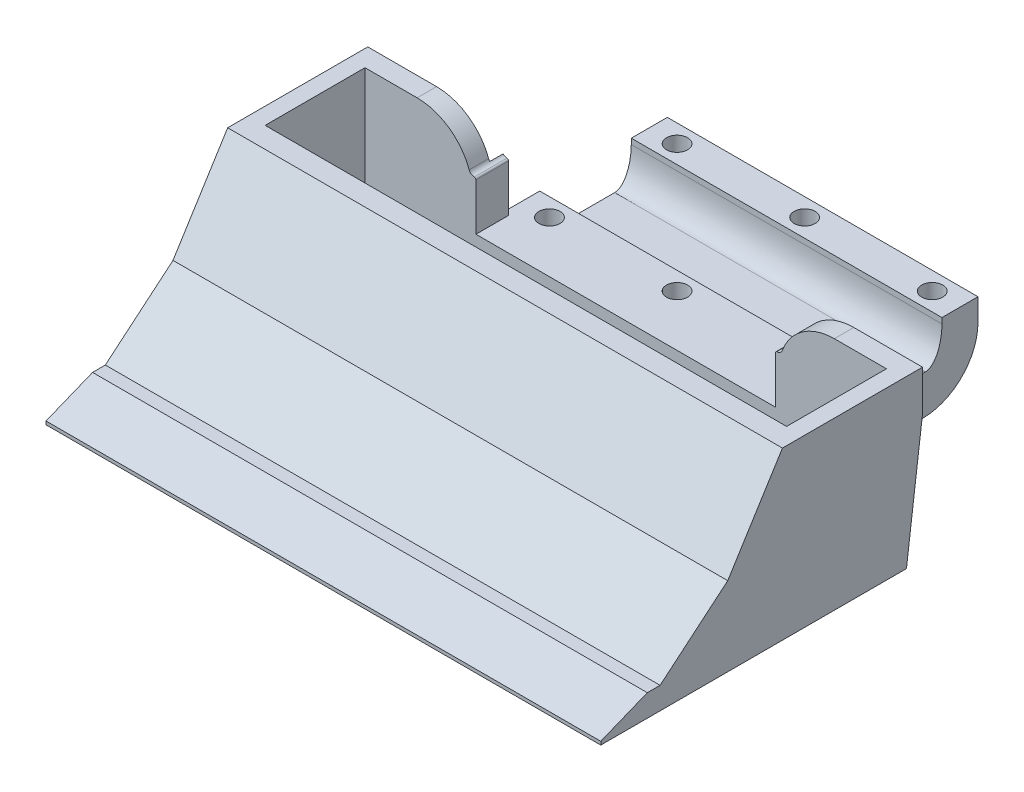
from build123d import *

# Parameters (mm, degrees)
RESSALTO_EXTRUS_O1_DEPTH = 30
CORTE_EXTRUS_O1_DEPTH    = 100
ESBO_O4_W                = 94
ESBO_O4_H                = 25
CORTE_EXTRUS_O2_DEPTH    = 10
ESBO_O5_W                = 94
ESBO_O5_H                = 18
CORTE_EXTRUS_O3_DEPTH    = 20
CORTE_EXTRUS_O7_START    = -3
CORTE_EXTRUS_O7_DEPTH    = 94
ESBO_O8_W                = 32
ESBO_O8_H                = 15
CORTE_EXTRUS_O8_DEPTH    = 56
ESBO_O9_W                = 16.5
ESBO_O9_H                = 8
CORTE_EXTRUS_O9_DEPTH    = 56
FILETE1_SIZE             = 3
FILETE1_SIZE_2           = 6
FILETE2_SIZE             = 3
FILETE2_SIZE_2           = 6
FILETE3_R                = 10
ESBO_O12_W               = 32
ESBO_O12_H               = 1
CORTE_EXTRUS_O12_DEPTH   = 68
CORTE_EXTRUS_O13_REACH   = 121.432
ESBO_O14_W               = 56
ESBO_O14_H               = 16
CORTE_EXTRUS_O14_DEPTH   = 138.840487586
ESBO_O16_R               = 1.9
CORTE_EXTRUS_O15_DEPTH   = 136.484316502
ESBO_O19_W               = 5.89
ESBO_O19_H               = 8.8
RESSALTO_EXTRUS_O4_DEPTH = 1
ESBO_O20_W               = 5.89
ESBO_O20_H               = 8.8
RESSALTO_EXTRUS_O5_DEPTH = 1
FILETE5_R                = 10
FILETE6_R                = 0.3
FILETE7_R                = 1
CORTE_EXTRUS_O17_DEPTH   = 22
CORTE_EXTRUS_O18_DEPTH   = 22
CORTE_EXTRUS_O19_DEPTH   = 124


with BuildPart() as part:
    # Esboço2 → Ressalto-extrusão1 (new body)
    with BuildSketch(Plane(origin=(0, 0, 0), x_dir=(1, 0, 0), z_dir=(0, 1, 0))):
        Polygon((0, 0), (0, 58), (22, 58), (22, 90), (78, 90), (78, 58), (100, 58), (100, 0), align=None)
    extrude(amount=RESSALTO_EXTRUS_O1_DEPTH)

    # Esboço3 → Corte-extrusão1 (cut)
    with BuildSketch(Plane(origin=(100, 0, 0), x_dir=(0, 0, -1), z_dir=(1, 0, 0))):
        Polygon((0, 0.6), (9.828405069, 4.570933406), (22.126818959, 14.890527965), (31.568264957, 30), (0, 30), align=None)
    extrude(amount=-CORTE_EXTRUS_O1_DEPTH, mode=Mode.SUBTRACT)

    # Esboço4 → Corte-extrusão2 (cut)
    with BuildSketch(Plane.XZ):
        with Locations((50, -40.5)):
            Rectangle(ESBO_O4_W, ESBO_O4_H)
    extrude(amount=-CORTE_EXTRUS_O2_DEPTH, mode=Mode.SUBTRACT)

    # Esboço5 → Corte-extrusão3 (cut)
    with BuildSketch(Plane(origin=(0, 30, 0), x_dir=(1, 0, 0), z_dir=(0, 1, 0))):
        with Locations((50, 45.5)):
            Rectangle(ESBO_O5_W, ESBO_O5_H)
    extrude(amount=-CORTE_EXTRUS_O3_DEPTH, mode=Mode.SUBTRACT)

    # Esboço7 → Corte-extrusão7 (cut)
    with BuildSketch(Plane(origin=(100, 0, 0), x_dir=(0, 0, -1), z_dir=(1, 0, 0)).offset(CORTE_EXTRUS_O7_START)):
        Polygon((28, 10), (36.5, 30), (36.5, 10), align=None)
    extrude(amount=-CORTE_EXTRUS_O7_DEPTH, mode=Mode.SUBTRACT)

    # Esboço8 → Corte-extrusão8 (cut)
    with BuildSketch(Plane(origin=(78, 0, 0), x_dir=(0, 0, -1), z_dir=(1, 0, 0))):
        with Locations((74, 22.5)):
            Rectangle(ESBO_O8_W, ESBO_O8_H)
    extrude(amount=-CORTE_EXTRUS_O8_DEPTH, mode=Mode.SUBTRACT)

    # Esboço9 → Corte-extrusão9 (cut)
    with BuildSketch(Plane(origin=(78, 0, 0), x_dir=(0, 0, -1), z_dir=(1, 0, 0))):
        with Locations((75.25, 11)):
            Rectangle(ESBO_O9_W, ESBO_O9_H)
    extrude(amount=-CORTE_EXTRUS_O9_DEPTH, mode=Mode.SUBTRACT)

    # Filete1
    # an asymmetric fillet: 6, 3 mm, written as the material it adds along each edge
    with BuildSketch(Plane(origin=(78, 7, -67), x_dir=(0, 0, -1), z_dir=(-1, 0, 0))) as filete1_piece_1:
        with BuildLine():
            Bezier((FILETE1_SIZE, 0), (0, 0), (0, -FILETE1_SIZE_2), weights=[1, 0.707106781, 1])
            Line((0, -FILETE1_SIZE_2), (0, 0))
            Line((0, 0), (FILETE1_SIZE, 0))
        make_face()
    extrude(amount=56)

    # Filete2
    # an asymmetric fillet: 6, 3 mm, written as the material it adds along each edge
    with BuildSketch(Plane(origin=(78, 7, -83.5), x_dir=(0, 0, 1), z_dir=(-1, 0, 0))) as filete2_piece_1:
        with BuildLine():
            Bezier((FILETE2_SIZE, 0), (0, 0), (0, FILETE2_SIZE_2), weights=[1, 0.707106781, 1])
            Line((0, FILETE2_SIZE_2), (0, 0))
            Line((0, 0), (FILETE2_SIZE, 0))
        make_face()
    extrude(amount=56)

    # Filete3
    filete3_edges = [part.edges().sort_by_distance(p)[0] for p in [
        (50, 0, -90),
    ]]
    fillet(filete3_edges, radius=FILETE3_R)

    # Esboço12 → Corte-extrusão12 (cut)
    with BuildSketch(Plane.ZY.offset(-22)):
        with Locations((-74, 14.5)):
            Rectangle(ESBO_O12_W, ESBO_O12_H)
    extrude(amount=-CORTE_EXTRUS_O12_DEPTH, mode=Mode.SUBTRACT)

    # Esboço14 → Corte-extrusão13 (cut, up to next)
    with BuildSketch(Plane(origin=(0, 0, -58), x_dir=(-1, 0, 0), z_dir=(0, 0, -1)), mode=Mode.PRIVATE) as corte_extrus_o13_sk1:
        with Locations((-50, 22)):
            Rectangle(ESBO_O14_W, ESBO_O14_H)
    corte_extrus_o13_tool1 = extrude(corte_extrus_o13_sk1.sketch, amount=-CORTE_EXTRUS_O13_REACH, mode=Mode.PRIVATE) & part.part
    add(corte_extrus_o13_tool1.solids().sort_by_distance((50, 22, -58))[0], mode=Mode.SUBTRACT)

    # Esboço15 → Corte-extrusão14 (cut, through all)
    with BuildSketch(Plane(origin=(100, 0, 0), x_dir=(0, 0, -1), z_dir=(1, 0, 0))):
        Polygon((9.048997211, 4.256032191), (10.048997211, 4.256032191), (10.048997211, 4.756032191), align=None)
    extrude(amount=-CORTE_EXTRUS_O14_DEPTH, mode=Mode.SUBTRACT)

    # Esboço16 → Corte-extrusão15 (cut, through all)
    with BuildSketch(Plane(origin=(0, 14, 0), x_dir=(1, 0, 0), z_dir=(0, 1, 0))):
        with Locations(Location((73, 86.75, 0), (0, 0, 270))):
            Circle(ESBO_O16_R)
        with Locations(Location((27, 86.75, 0), (0, 0, 270))):
            Circle(ESBO_O16_R)
        with Locations(Location((73, 63.75, 0), (0, 0, 90))):
            Circle(ESBO_O16_R)
        with Locations(Location((27, 63.75, 0), (0, 0, 90))):
            Circle(ESBO_O16_R)
        with Locations(Location((50, 86.75, 0), (0, 0, 270))):
            Circle(ESBO_O16_R)
        with Locations(Location((50, 63.75, 0), (0, 0, 90))):
            Circle(ESBO_O16_R)
    extrude(amount=-CORTE_EXTRUS_O15_DEPTH, mode=Mode.SUBTRACT)

    # Esboço19 → Ressalto-extrusão4 (add)
    with BuildSketch(Plane.ZY.offset(-78)):
        with Locations((-57.445, 18.4)):
            Rectangle(ESBO_O19_W, ESBO_O19_H)
    extrude(amount=RESSALTO_EXTRUS_O4_DEPTH)

    # Esboço20 → Ressalto-extrusão5 (add)
    with BuildSketch(Plane(origin=(22, 0, 0), x_dir=(0, 0, -1), z_dir=(1, 0, 0))):
        with Locations((57.445, 18.4)):
            Rectangle(ESBO_O20_W, ESBO_O20_H)
    extrude(amount=RESSALTO_EXTRUS_O5_DEPTH)

    # Filete5
    # the kernel refuses this fillet: 10 mm, written as the material it takes off along each edge
    with BuildSketch(Plane(origin=(22, 30, -82), x_dir=(0, -1, 0), z_dir=(0, 0, 1))) as filete5_piece_1_section:
        with BuildLine():
            CenterArc((10, -9.6), FILETE5_R, 106.260204708, 73.739795292)
            Line((0, -9.6), (0, 0))
            Line((0, 0), (7.2, 0))
        make_face()
    filete5_piece_1 = extrude(amount=51.5, mode=Mode.PRIVATE)
    filete5_piece_1 = split(filete5_piece_1, bisect_by=Plane(origin=(18.412, 35.429115934, -38.807374272), z_dir=(0, -0.39114064034485163, -0.9203309184584747)), keep=Keep.TOP, mode=Mode.PRIVATE)
    add(filete5_piece_1, mode=Mode.SUBTRACT)
    with BuildSketch(Plane(origin=(78, 30, -82), x_dir=(0, -1, 0), z_dir=(0, 0, 1))) as filete5_piece_2_section:
        with BuildLine():
            CenterArc((10, 9.6), FILETE5_R, 180, 73.739795292)
            Line((0, 9.6), (0, 0))
            Line((0, 0), (7.2, 0))
        make_face()
    filete5_piece_2 = extrude(amount=51.5, mode=Mode.PRIVATE)
    filete5_piece_2 = split(filete5_piece_2, bisect_by=Plane(origin=(81.588, 35.429115934, -38.807374272), z_dir=(0, -0.39114064034485163, -0.9203309184584747)), keep=Keep.TOP, mode=Mode.PRIVATE)
    add(filete5_piece_2, mode=Mode.SUBTRACT)

    # Filete6
    filete6_edges = [part.edges().sort_by_distance(p)[0] for p in [
        (77, 22.8, -57.445),
        (23, 22.8, -57.445),
    ]]
    fillet(filete6_edges, radius=FILETE6_R)

    # Filete7
    # the kernel refuses this fillet: 1 mm, written as the material it adds along each edge
    with BuildSketch(Plane(origin=(22, 22.8, -62.231658327), x_dir=(0.9999999978354762, -6.579549656677086e-05, 0), z_dir=(0, 0, 1))) as filete7_piece_1_section:
        with BuildLine():
            CenterArc((0.722798557, 0.999846475), FILETE7_R, 200.212199082, 68.783803201)
            Line((-0.215620926, 0.654348465), (-0.309462874, 0.619798664))
            ThreePointArc((-0.309462874, 0.619798664), (-0.197149972, 0.297735075), (-0.095998158, -0.028006316))
            Line((-0.095998158, -0.028006316), (6.58e-06, -0.1))
            ThreePointArc((6.58e-06, -0.1), (0.700006578, -0.099953943), (0.703524171, -0.099984648))
            Line((0.703524171, -0.099984648), (0.705276388, 0))
        make_face()
    filete7_piece_1 = extrude(amount=7.731658327, mode=Mode.PRIVATE)
    filete7_piece_1 = split(filete7_piece_1, bisect_by=Plane(origin=(22.2637133, 22.819694308, -60.39), z_dir=(0, 0, 1)), keep=Keep.TOP, mode=Mode.PRIVATE)
    filete7_piece_1 = split(filete7_piece_1, bisect_by=Plane(origin=(22, 22.819694308, -59.195), z_dir=(1, 0, 0)), keep=Keep.TOP, mode=Mode.PRIVATE)
    filete7_piece_1 = split(filete7_piece_1, bisect_by=Plane(origin=(22.2637133, 22.819694308, -58), z_dir=(0, 0, -1)), keep=Keep.TOP, mode=Mode.PRIVATE)
    add(filete7_piece_1)
    with BuildSketch(Plane(origin=(22, 22.8, -58), x_dir=(0.9999999978354763, -6.579549656677353e-05, 0), z_dir=(0, 0, 1))) as filete7_piece_2_section:
        with BuildLine():
            CenterArc((0.722798557, 0.999846475), FILETE7_R, 200.212199082, 68.783803201)
            Line((-0.215620926, 0.654348465), (-0.309462874, 0.619798664))
            ThreePointArc((-0.309462874, 0.619798664), (-0.197149972, 0.297735075), (-0.095998158, -0.028006316))
            Line((-0.095998158, -0.028006316), (6.58e-06, -0.1))
            ThreePointArc((6.58e-06, -0.1), (0.700006578, -0.099953943), (0.703524171, -0.099984648))
            Line((0.703524171, -0.099984648), (0.705276388, 0))
        make_face()
    filete7_piece_2 = extrude(amount=3.5, mode=Mode.PRIVATE)
    filete7_piece_2 = split(filete7_piece_2, bisect_by=Plane(origin=(22, 22.819694308, -56.25), z_dir=(1, 0, 0)), keep=Keep.TOP, mode=Mode.PRIVATE)
    add(filete7_piece_2)
    with BuildSketch(Plane(origin=(22, 22.8, -58), x_dir=(0.9999999978354763, -6.579549656677353e-05, 0), z_dir=(0, 0, 1))) as filete7_piece_3_section:
        with BuildLine():
            CenterArc((0.722798557, 0.999846475), FILETE7_R, 200.212199082, 68.783803201)
            Line((-0.215620926, 0.654348465), (-0.309462874, 0.619798664))
            ThreePointArc((-0.309462874, 0.619798664), (-0.197149972, 0.297735075), (-0.095998158, -0.028006316))
            Line((-0.095998158, -0.028006316), (6.58e-06, -0.1))
            ThreePointArc((6.58e-06, -0.1), (0.700006578, -0.099953943), (0.703524171, -0.099984648))
            Line((0.703524171, -0.099984648), (0.705276388, 0))
        make_face()
    filete7_piece_3 = extrude(amount=3.5, mode=Mode.PRIVATE)
    filete7_piece_3 = split(filete7_piece_3, bisect_by=Plane(origin=(22, 23.088269834, -56.25), z_dir=(-1, 0, 0)), keep=Keep.TOP, mode=Mode.PRIVATE)
    add(filete7_piece_3)
    with BuildSketch(Plane(origin=(78, 22.8, -62.231658327), x_dir=(-0.9999999978354763, -6.579549656677353e-05, 0), z_dir=(0, 0, 1))) as filete7_piece_4_section:
        with BuildLine():
            CenterArc((0.722798557, -0.999846475), FILETE7_R, 91.003997717, 68.783803201)
            Line((-0.215620926, -0.654348465), (-0.309462874, -0.619798664))
            ThreePointArc((-0.309462874, -0.619798664), (-0.197149972, -0.297735075), (-0.095998158, 0.028006316))
            Line((-0.095998158, 0.028006316), (6.58e-06, 0.1))
            ThreePointArc((6.58e-06, 0.1), (0.700006578, 0.099953943), (0.703524171, 0.099984648))
            Line((0.703524171, 0.099984648), (0.705276388, 0))
        make_face()
    filete7_piece_4 = extrude(amount=7.731658327, mode=Mode.PRIVATE)
    filete7_piece_4 = split(filete7_piece_4, bisect_by=Plane(origin=(78, 22.819694308, -59.195), z_dir=(-1, 0, 0)), keep=Keep.TOP, mode=Mode.PRIVATE)
    filete7_piece_4 = split(filete7_piece_4, bisect_by=Plane(origin=(77.7362867, 22.819694308, -60.39), z_dir=(0, 0, 1)), keep=Keep.TOP, mode=Mode.PRIVATE)
    filete7_piece_4 = split(filete7_piece_4, bisect_by=Plane(origin=(77.7362867, 22.819694308, -58), z_dir=(0, 0, -1)), keep=Keep.TOP, mode=Mode.PRIVATE)
    add(filete7_piece_4)
    with BuildSketch(Plane(origin=(78, 22.8, -58), x_dir=(-0.9999999978354763, -6.57954965667722e-05, 0), z_dir=(0, 0, 1))) as filete7_piece_5_section:
        with BuildLine():
            CenterArc((0.722798557, -0.999846475), FILETE7_R, 91.003997717, 68.783803201)
            Line((-0.215620926, -0.654348465), (-0.309462874, -0.619798664))
            ThreePointArc((-0.309462874, -0.619798664), (-0.197149972, -0.297735075), (-0.095998158, 0.028006316))
            Line((-0.095998158, 0.028006316), (6.58e-06, 0.1))
            ThreePointArc((6.58e-06, 0.1), (0.700006578, 0.099953943), (0.703524171, 0.099984648))
            Line((0.703524171, 0.099984648), (0.705276388, 0))
        make_face()
    filete7_piece_5 = extrude(amount=3.5, mode=Mode.PRIVATE)
    filete7_piece_5 = split(filete7_piece_5, bisect_by=Plane(origin=(78, 22.819694308, -56.25), z_dir=(-1, 0, 0)), keep=Keep.TOP, mode=Mode.PRIVATE)
    add(filete7_piece_5)
    with BuildSketch(Plane(origin=(78, 22.8, -58), x_dir=(-0.9999999978354763, -6.57954965667722e-05, 0), z_dir=(0, 0, 1))) as filete7_piece_6_section:
        with BuildLine():
            CenterArc((0.722798557, -0.999846475), FILETE7_R, 91.003997717, 68.783803201)
            Line((-0.215620926, -0.654348465), (-0.309462874, -0.619798664))
            ThreePointArc((-0.309462874, -0.619798664), (-0.197149972, -0.297735075), (-0.095998158, 0.028006316))
            Line((-0.095998158, 0.028006316), (6.58e-06, 0.1))
            ThreePointArc((6.58e-06, 0.1), (0.700006578, 0.099953943), (0.703524171, 0.099984648))
            Line((0.703524171, 0.099984648), (0.705276388, 0))
        make_face()
    filete7_piece_6 = extrude(amount=3.5, mode=Mode.PRIVATE)
    filete7_piece_6 = split(filete7_piece_6, bisect_by=Plane(origin=(78, 23.088269834, -56.25), z_dir=(1, 0, 0)), keep=Keep.TOP, mode=Mode.PRIVATE)
    add(filete7_piece_6)

    # Esboço22 → Corte-extrusão17 (cut)
    with BuildSketch(Plane.ZY):
        Polygon((-58, 0), (-58, 22.70530007), (-55.105367164, 0), align=None)
    extrude(amount=-CORTE_EXTRUS_O17_DEPTH, mode=Mode.SUBTRACT)

    # Esboço23 → Corte-extrusão18 (cut)
    with BuildSketch(Plane(origin=(100, 0, 0), x_dir=(0, 0, -1), z_dir=(1, 0, 0))):
        Polygon((58, 0), (55.102867158, 0), (58, 22.71), align=None)
    extrude(amount=-CORTE_EXTRUS_O18_DEPTH, mode=Mode.SUBTRACT)

    # Esboço27 → Corte-extrusão19 (cut)
    with BuildSketch(Plane.ZY):
        Polygon((-31.568264957, 30), (-22.126818959, 14.890527965), (-10.048997211, 4.756032191), (-7.995032748, 3.989987748), (-10.691784821, 3.989987748), (-22.89093609, 14.226291078), (-32.747443361, 30), align=None)
    extrude(amount=-CORTE_EXTRUS_O19_DEPTH, mode=Mode.SUBTRACT)


solid = part.part
